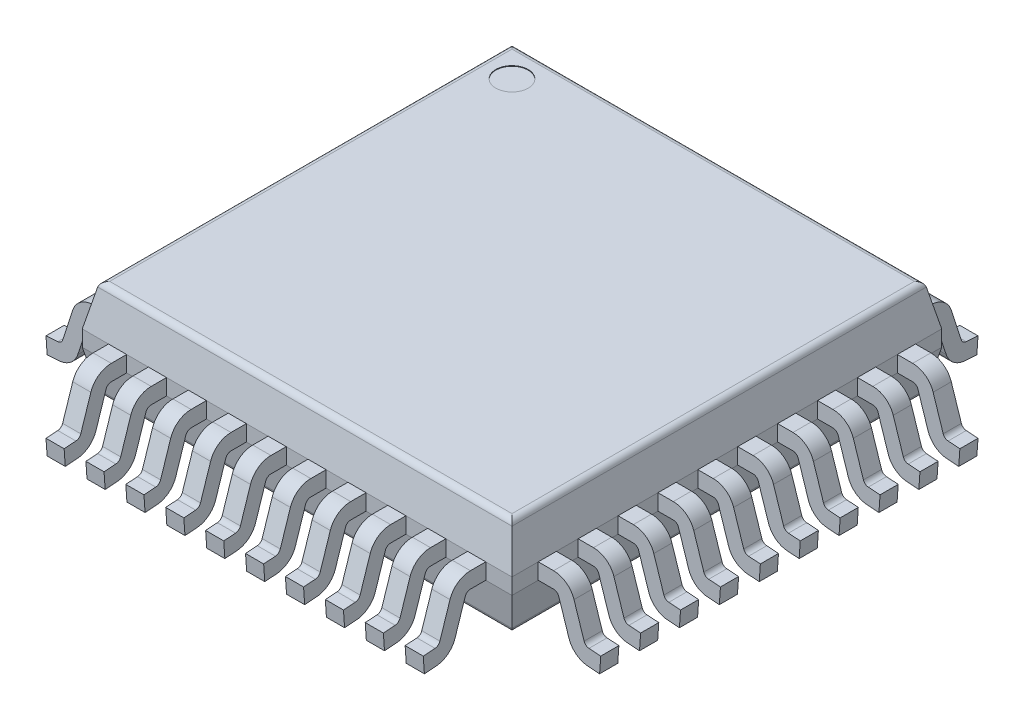
from build123d import *
from OCP.BRepFilletAPI import BRepFilletAPI_MakeChamfer

# Parameters (mm, degrees)
SKETCH1_W             = 7
SKETCH1_H             = 7
BODY_DEPTH            = 1.6
BODY_CHAMFER_SIZE     = 0.67
BODY_CHAMFER_SIZE2    = 0.142412896
FILLET1_R             = 0.1
SKETCH2_R             = 0.263534387
PIN_1_INDENT_DEPTH    = 0.01
PIN_DEPTH             = 0.147727273
LPATTERN1_COUNT       = 10
LPATTERN1_PITCH       = 0.65
MIRROR1_COPY_1_DEPTH  = 0.147727273
MIRROR1_COPY_2_DEPTH  = 0.147727273
MIRROR1_COPY_3_DEPTH  = 0.147727273
MIRROR1_COPY_4_DEPTH  = 0.147727273
MIRROR1_COPY_5_DEPTH  = 0.147727273
MIRROR1_COPY_6_DEPTH  = 0.147727273
MIRROR1_COPY_7_DEPTH  = 0.147727273
MIRROR1_COPY_8_DEPTH  = 0.147727273
MIRROR1_COPY_9_DEPTH  = 0.147727273
MIRROR2_COPY_1_DEPTH  = 0.147727273
MIRROR2_COPY_2_DEPTH  = 0.147727273
MIRROR2_COPY_3_DEPTH  = 0.147727273
MIRROR2_COPY_4_DEPTH  = 0.147727273
MIRROR2_COPY_5_DEPTH  = 0.147727273
MIRROR2_COPY_6_DEPTH  = 0.147727273
MIRROR2_COPY_7_DEPTH  = 0.147727273
MIRROR2_COPY_8_DEPTH  = 0.147727273
MIRROR2_COPY_9_DEPTH  = 0.147727273
MIRROR2_COPY_10_DEPTH = 0.147727273
MIRROR2_COPY_11_DEPTH = 0.147727273
MIRROR3_START         = -3.072727273
MIRROR3_DEPTH         = 0.295454546
MIRROR3_START_2       = -2.422727273
MIRROR3_2_DEPTH       = 0.295454546
MIRROR3_START_3       = -1.772727273
MIRROR3_3_DEPTH       = 0.295454546
MIRROR3_START_4       = -1.122727273
MIRROR3_4_DEPTH       = 0.295454546
MIRROR3_START_5       = -0.472727273
MIRROR3_5_DEPTH       = 0.295454546
MIRROR3_START_6       = 0.177272727
MIRROR3_6_DEPTH       = 0.295454546
MIRROR3_START_7       = 0.827272727
MIRROR3_7_DEPTH       = 0.295454546
MIRROR3_START_8       = 1.477272727
MIRROR3_8_DEPTH       = 0.295454546
MIRROR3_START_9       = 2.127272727
MIRROR3_9_DEPTH       = 0.295454546
MIRROR3_START_10      = 2.777272727
MIRROR3_10_DEPTH      = 0.295454546


# Read off the part's stored shape, not the designer's step: Mirror3
with BuildPart() as part:
    # Sketch1 → Body (new body)
    with BuildSketch(Plane(origin=(0, 0.15, 0), x_dir=(-1, 0, 0), z_dir=(0, 1, 0))):
        Rectangle(SKETCH1_W, SKETCH1_H)
    extrude(amount=BODY_DEPTH)

    # Body Chamfer: one chamfer whose edges measure the first distance from different faces: ONE call of the kernel's chamfer builder (chamfer() names one face for all edges)
    body_chamfer_edges_1 = [part.edges().sort_by_distance(p)[0] for p in [
        (3.5, 1.75, 0),
        (3.5, 0.15, 0),
    ]]
    body_chamfer_side_1 = [part.faces().sort_by_distance(p)[0] for p in [
        (3.5, 0.95, 0),
    ]]
    body_chamfer_edges_2 = [part.edges().sort_by_distance(p)[0] for p in [
        (0, 1.75, -3.5),
        (0, 0.15, -3.5),
    ]]
    body_chamfer_side_2 = [part.faces().sort_by_distance(p)[0] for p in [
        (0, 0.95, -3.5),
    ]]
    body_chamfer_edges_3 = [part.edges().sort_by_distance(p)[0] for p in [
        (-3.5, 1.75, 0),
        (-3.5, 0.15, 0),
    ]]
    body_chamfer_side_3 = [part.faces().sort_by_distance(p)[0] for p in [
        (-3.5, 0.95, 0),
    ]]
    body_chamfer_edges_4 = [part.edges().sort_by_distance(p)[0] for p in [
        (0, 0.15, 3.5),
        (0, 1.75, 3.5),
    ]]
    body_chamfer_side_4 = [part.faces().sort_by_distance(p)[0] for p in [
        (0, 0.95, 3.5),
    ]]
    body_chamfer = BRepFilletAPI_MakeChamfer(part.part.solid().wrapped)
    for e in body_chamfer_edges_1:
        body_chamfer.Add(BODY_CHAMFER_SIZE, BODY_CHAMFER_SIZE2, e.wrapped, body_chamfer_side_1[0].wrapped)  # the first distance lies on this face
    for e in body_chamfer_edges_2:
        body_chamfer.Add(BODY_CHAMFER_SIZE, BODY_CHAMFER_SIZE2, e.wrapped, body_chamfer_side_2[0].wrapped)  # the first distance lies on this face
    for e in body_chamfer_edges_3:
        body_chamfer.Add(BODY_CHAMFER_SIZE, BODY_CHAMFER_SIZE2, e.wrapped, body_chamfer_side_3[0].wrapped)  # the first distance lies on this face
    for e in body_chamfer_edges_4:
        body_chamfer.Add(BODY_CHAMFER_SIZE, BODY_CHAMFER_SIZE2, e.wrapped, body_chamfer_side_4[0].wrapped)  # the first distance lies on this face
    add(Compound.cast(body_chamfer.Shape()), mode=Mode.REPLACE)

    # Fillet1
    fillet1_edges = [part.edges().sort_by_distance(p)[0] for p in [
        (-3.357587104, 0.15, 0),
        (0, 0.15, -3.357587104),
        (3.357587104, 0.15, 0),
        (0, 0.15, 3.357587104),
        (-3.357587104, 1.75, 0),
        (0, 1.75, 3.357587104),
        (3.357587104, 1.75, 0),
        (0, 1.75, -3.357587104),
    ]]
    fillet(fillet1_edges, radius=FILLET1_R)

    # Sketch2 → Pin #1 Indent (cut)
    with BuildSketch(Plane(origin=(0, 1.75, 0), x_dir=(1, 0, 0), z_dir=(0, 1, 0))):
        with Locations(Location((-2.857587104, 2.857587104, 0), (0, 0, 270))):
            Circle(SKETCH2_R)
    extrude(amount=-PIN_1_INDENT_DEPTH, mode=Mode.SUBTRACT)

    # Sketch3 → Pin (add, symmetric)
    with BuildSketch(Plane.XY.offset(2.925)):
        with BuildLine():
            Line((-4.5, 0), (-4.308319039, 0.013403639))
            ThreePointArc((-4.308319039, 0.013403639), (-4.11742537, 0.086612153), (-4, 0.253977508))
            Line((-4, 0.253977508), (-3.835560121, 0.757918912))
            ThreePointArc((-3.835560121, 0.757918912), (-3.80285498, 0.802844705), (-3.75, 0.82))
            Line((-3.75, 0.82), (-3.5, 0.82))
            Line((-3.5, 0.82), (-3.5, 1.08))
            Line((-3.5, 1.08), (-3.75, 1.08))
            ThreePointArc((-3.75, 1.08), (-3.955547146, 1.013284964), (-4.082733804, 0.838573548))
            Line((-4.082733804, 0.838573548), (-4.247173683, 0.334632144))
            ThreePointArc((-4.247173683, 0.334632144), (-4.277368778, 0.291595338), (-4.326455722, 0.272770292))
            Line((-4.326455722, 0.272770292), (-4.518136683, 0.259366653))
            Line((-4.518136683, 0.259366653), (-4.5, 0))
        make_face()
    pin = extrude(amount=PIN_DEPTH, both=True)

    # LPattern1: Pin ×10
    with Locations(*[(0, 0, -i * LPATTERN1_PITCH) for i in range(1, LPATTERN1_COUNT)]):
        add(pin)

    # Mirror1: Pin across plane
    add(pin.mirror(Plane(origin=(0, 0, 0), x_dir=(-0.7071067811865563, 0, 0.7071067811865387), z_dir=(0.7071067811865389, 0, 0.7071067811865562))))

    # Mirror1 copy 1 sketch → Mirror1 copy 1 (add, symmetric)
    with BuildSketch(Plane(origin=(-2.275, 0, 0), x_dir=(0, 0, -1), z_dir=(-1, 0, 0))):
        with BuildLine():
            Line((-4.5, 0), (-4.308319039, -0.013403639))
            ThreePointArc((-4.308319039, -0.013403639), (-4.11742537, -0.086612153), (-4, -0.253977508))
            Line((-4, -0.253977508), (-3.835560121, -0.757918912))
            ThreePointArc((-3.835560121, -0.757918912), (-3.80285498, -0.802844705), (-3.75, -0.82))
            Line((-3.75, -0.82), (-3.5, -0.82))
            Line((-3.5, -0.82), (-3.5, -1.08))
            Line((-3.5, -1.08), (-3.75, -1.08))
            ThreePointArc((-3.75, -1.08), (-3.955547146, -1.013284964), (-4.082733804, -0.838573548))
            Line((-4.082733804, -0.838573548), (-4.247173683, -0.334632144))
            ThreePointArc((-4.247173683, -0.334632144), (-4.277368778, -0.291595338), (-4.326455722, -0.272770292))
            Line((-4.326455722, -0.272770292), (-4.518136683, -0.259366653))
            Line((-4.518136683, -0.259366653), (-4.5, 0))
        make_face()
    extrude(amount=MIRROR1_COPY_1_DEPTH, both=True)

    # Mirror1 copy 2 sketch → Mirror1 copy 2 (add, symmetric)
    with BuildSketch(Plane(origin=(-1.625, 0, 0), x_dir=(0, 0, -1), z_dir=(-1, 0, 0))):
        with BuildLine():
            Line((-4.5, 0), (-4.308319039, -0.013403639))
            ThreePointArc((-4.308319039, -0.013403639), (-4.11742537, -0.086612153), (-4, -0.253977508))
            Line((-4, -0.253977508), (-3.835560121, -0.757918912))
            ThreePointArc((-3.835560121, -0.757918912), (-3.80285498, -0.802844705), (-3.75, -0.82))
            Line((-3.75, -0.82), (-3.5, -0.82))
            Line((-3.5, -0.82), (-3.5, -1.08))
            Line((-3.5, -1.08), (-3.75, -1.08))
            ThreePointArc((-3.75, -1.08), (-3.955547146, -1.013284964), (-4.082733804, -0.838573548))
            Line((-4.082733804, -0.838573548), (-4.247173683, -0.334632144))
            ThreePointArc((-4.247173683, -0.334632144), (-4.277368778, -0.291595338), (-4.326455722, -0.272770292))
            Line((-4.326455722, -0.272770292), (-4.518136683, -0.259366653))
            Line((-4.518136683, -0.259366653), (-4.5, 0))
        make_face()
    extrude(amount=MIRROR1_COPY_2_DEPTH, both=True)

    # Mirror1 copy 3 sketch → Mirror1 copy 3 (add, symmetric)
    with BuildSketch(Plane(origin=(-0.975, 0, 0), x_dir=(0, 0, -1), z_dir=(-1, 0, 0))):
        with BuildLine():
            Line((-4.5, 0), (-4.308319039, -0.013403639))
            ThreePointArc((-4.308319039, -0.013403639), (-4.11742537, -0.086612153), (-4, -0.253977508))
            Line((-4, -0.253977508), (-3.835560121, -0.757918912))
            ThreePointArc((-3.835560121, -0.757918912), (-3.80285498, -0.802844705), (-3.75, -0.82))
            Line((-3.75, -0.82), (-3.5, -0.82))
            Line((-3.5, -0.82), (-3.5, -1.08))
            Line((-3.5, -1.08), (-3.75, -1.08))
            ThreePointArc((-3.75, -1.08), (-3.955547146, -1.013284964), (-4.082733804, -0.838573548))
            Line((-4.082733804, -0.838573548), (-4.247173683, -0.334632144))
            ThreePointArc((-4.247173683, -0.334632144), (-4.277368778, -0.291595338), (-4.326455722, -0.272770292))
            Line((-4.326455722, -0.272770292), (-4.518136683, -0.259366653))
            Line((-4.518136683, -0.259366653), (-4.5, 0))
        make_face()
    extrude(amount=MIRROR1_COPY_3_DEPTH, both=True)

    # Mirror1 copy 4 sketch → Mirror1 copy 4 (add, symmetric)
    with BuildSketch(Plane(origin=(-0.325, 0, 0), x_dir=(0, 0, -1), z_dir=(-1, 0, 0))):
        with BuildLine():
            Line((-4.5, 0), (-4.308319039, -0.013403639))
            ThreePointArc((-4.308319039, -0.013403639), (-4.11742537, -0.086612153), (-4, -0.253977508))
            Line((-4, -0.253977508), (-3.835560121, -0.757918912))
            ThreePointArc((-3.835560121, -0.757918912), (-3.80285498, -0.802844705), (-3.75, -0.82))
            Line((-3.75, -0.82), (-3.5, -0.82))
            Line((-3.5, -0.82), (-3.5, -1.08))
            Line((-3.5, -1.08), (-3.75, -1.08))
            ThreePointArc((-3.75, -1.08), (-3.955547146, -1.013284964), (-4.082733804, -0.838573548))
            Line((-4.082733804, -0.838573548), (-4.247173683, -0.334632144))
            ThreePointArc((-4.247173683, -0.334632144), (-4.277368778, -0.291595338), (-4.326455722, -0.272770292))
            Line((-4.326455722, -0.272770292), (-4.518136683, -0.259366653))
            Line((-4.518136683, -0.259366653), (-4.5, 0))
        make_face()
    extrude(amount=MIRROR1_COPY_4_DEPTH, both=True)

    # Mirror1 copy 5 sketch → Mirror1 copy 5 (add, symmetric)
    with BuildSketch(Plane(origin=(0.325, 0, 0), x_dir=(0, 0, -1), z_dir=(-1, 0, 0))):
        with BuildLine():
            Line((-4.5, 0), (-4.308319039, -0.013403639))
            ThreePointArc((-4.308319039, -0.013403639), (-4.11742537, -0.086612153), (-4, -0.253977508))
            Line((-4, -0.253977508), (-3.835560121, -0.757918912))
            ThreePointArc((-3.835560121, -0.757918912), (-3.80285498, -0.802844705), (-3.75, -0.82))
            Line((-3.75, -0.82), (-3.5, -0.82))
            Line((-3.5, -0.82), (-3.5, -1.08))
            Line((-3.5, -1.08), (-3.75, -1.08))
            ThreePointArc((-3.75, -1.08), (-3.955547146, -1.013284964), (-4.082733804, -0.838573548))
            Line((-4.082733804, -0.838573548), (-4.247173683, -0.334632144))
            ThreePointArc((-4.247173683, -0.334632144), (-4.277368778, -0.291595338), (-4.326455722, -0.272770292))
            Line((-4.326455722, -0.272770292), (-4.518136683, -0.259366653))
            Line((-4.518136683, -0.259366653), (-4.5, 0))
        make_face()
    extrude(amount=MIRROR1_COPY_5_DEPTH, both=True)

    # Mirror1 copy 6 sketch → Mirror1 copy 6 (add, symmetric)
    with BuildSketch(Plane(origin=(0.975, 0, 0), x_dir=(0, 0, -1), z_dir=(-1, 0, 0))):
        with BuildLine():
            Line((-4.5, 0), (-4.308319039, -0.013403639))
            ThreePointArc((-4.308319039, -0.013403639), (-4.11742537, -0.086612153), (-4, -0.253977508))
            Line((-4, -0.253977508), (-3.835560121, -0.757918912))
            ThreePointArc((-3.835560121, -0.757918912), (-3.80285498, -0.802844705), (-3.75, -0.82))
            Line((-3.75, -0.82), (-3.5, -0.82))
            Line((-3.5, -0.82), (-3.5, -1.08))
            Line((-3.5, -1.08), (-3.75, -1.08))
            ThreePointArc((-3.75, -1.08), (-3.955547146, -1.013284964), (-4.082733804, -0.838573548))
            Line((-4.082733804, -0.838573548), (-4.247173683, -0.334632144))
            ThreePointArc((-4.247173683, -0.334632144), (-4.277368778, -0.291595338), (-4.326455722, -0.272770292))
            Line((-4.326455722, -0.272770292), (-4.518136683, -0.259366653))
            Line((-4.518136683, -0.259366653), (-4.5, 0))
        make_face()
    extrude(amount=MIRROR1_COPY_6_DEPTH, both=True)

    # Mirror1 copy 7 sketch → Mirror1 copy 7 (add, symmetric)
    with BuildSketch(Plane(origin=(1.625, 0, 0), x_dir=(0, 0, -1), z_dir=(-1, 0, 0))):
        with BuildLine():
            Line((-4.5, 0), (-4.308319039, -0.013403639))
            ThreePointArc((-4.308319039, -0.013403639), (-4.11742537, -0.086612153), (-4, -0.253977508))
            Line((-4, -0.253977508), (-3.835560121, -0.757918912))
            ThreePointArc((-3.835560121, -0.757918912), (-3.80285498, -0.802844705), (-3.75, -0.82))
            Line((-3.75, -0.82), (-3.5, -0.82))
            Line((-3.5, -0.82), (-3.5, -1.08))
            Line((-3.5, -1.08), (-3.75, -1.08))
            ThreePointArc((-3.75, -1.08), (-3.955547146, -1.013284964), (-4.082733804, -0.838573548))
            Line((-4.082733804, -0.838573548), (-4.247173683, -0.334632144))
            ThreePointArc((-4.247173683, -0.334632144), (-4.277368778, -0.291595338), (-4.326455722, -0.272770292))
            Line((-4.326455722, -0.272770292), (-4.518136683, -0.259366653))
            Line((-4.518136683, -0.259366653), (-4.5, 0))
        make_face()
    extrude(amount=MIRROR1_COPY_7_DEPTH, both=True)

    # Mirror1 copy 8 sketch → Mirror1 copy 8 (add, symmetric)
    with BuildSketch(Plane(origin=(2.275, 0, 0), x_dir=(0, 0, -1), z_dir=(-1, 0, 0))):
        with BuildLine():
            Line((-4.5, 0), (-4.308319039, -0.013403639))
            ThreePointArc((-4.308319039, -0.013403639), (-4.11742537, -0.086612153), (-4, -0.253977508))
            Line((-4, -0.253977508), (-3.835560121, -0.757918912))
            ThreePointArc((-3.835560121, -0.757918912), (-3.80285498, -0.802844705), (-3.75, -0.82))
            Line((-3.75, -0.82), (-3.5, -0.82))
            Line((-3.5, -0.82), (-3.5, -1.08))
            Line((-3.5, -1.08), (-3.75, -1.08))
            ThreePointArc((-3.75, -1.08), (-3.955547146, -1.013284964), (-4.082733804, -0.838573548))
            Line((-4.082733804, -0.838573548), (-4.247173683, -0.334632144))
            ThreePointArc((-4.247173683, -0.334632144), (-4.277368778, -0.291595338), (-4.326455722, -0.272770292))
            Line((-4.326455722, -0.272770292), (-4.518136683, -0.259366653))
            Line((-4.518136683, -0.259366653), (-4.5, 0))
        make_face()
    extrude(amount=MIRROR1_COPY_8_DEPTH, both=True)

    # Mirror1 copy 9 sketch → Mirror1 copy 9 (add, symmetric)
    with BuildSketch(Plane(origin=(2.925, 0, 0), x_dir=(0, 0, -1), z_dir=(-1, 0, 0))):
        with BuildLine():
            Line((-4.5, 0), (-4.308319039, -0.013403639))
            ThreePointArc((-4.308319039, -0.013403639), (-4.11742537, -0.086612153), (-4, -0.253977508))
            Line((-4, -0.253977508), (-3.835560121, -0.757918912))
            ThreePointArc((-3.835560121, -0.757918912), (-3.80285498, -0.802844705), (-3.75, -0.82))
            Line((-3.75, -0.82), (-3.5, -0.82))
            Line((-3.5, -0.82), (-3.5, -1.08))
            Line((-3.5, -1.08), (-3.75, -1.08))
            ThreePointArc((-3.75, -1.08), (-3.955547146, -1.013284964), (-4.082733804, -0.838573548))
            Line((-4.082733804, -0.838573548), (-4.247173683, -0.334632144))
            ThreePointArc((-4.247173683, -0.334632144), (-4.277368778, -0.291595338), (-4.326455722, -0.272770292))
            Line((-4.326455722, -0.272770292), (-4.518136683, -0.259366653))
            Line((-4.518136683, -0.259366653), (-4.5, 0))
        make_face()
    extrude(amount=MIRROR1_COPY_9_DEPTH, both=True)

    # Mirror2 copy 1 sketch → Mirror2 copy 1 (add, symmetric)
    with BuildSketch(Plane.ZY.offset(2.925)):
        with BuildLine():
            Line((-4.5, 0), (-4.308319039, 0.013403639))
            ThreePointArc((-4.308319039, 0.013403639), (-4.11742537, 0.086612153), (-4, 0.253977508))
            Line((-4, 0.253977508), (-3.835560121, 0.757918912))
            ThreePointArc((-3.835560121, 0.757918912), (-3.80285498, 0.802844705), (-3.75, 0.82))
            Line((-3.75, 0.82), (-3.5, 0.82))
            Line((-3.5, 0.82), (-3.5, 1.08))
            Line((-3.5, 1.08), (-3.75, 1.08))
            ThreePointArc((-3.75, 1.08), (-3.955547146, 1.013284964), (-4.082733804, 0.838573548))
            Line((-4.082733804, 0.838573548), (-4.247173683, 0.334632144))
            ThreePointArc((-4.247173683, 0.334632144), (-4.277368778, 0.291595338), (-4.326455722, 0.272770292))
            Line((-4.326455722, 0.272770292), (-4.518136683, 0.259366653))
            Line((-4.518136683, 0.259366653), (-4.5, 0))
        make_face()
    extrude(amount=MIRROR2_COPY_1_DEPTH, both=True)

    # Mirror2 copy 2 sketch → Mirror2 copy 2 (add, symmetric)
    with BuildSketch(Plane.ZY.offset(2.275)):
        with BuildLine():
            Line((-4.5, 0), (-4.308319039, 0.013403639))
            ThreePointArc((-4.308319039, 0.013403639), (-4.11742537, 0.086612153), (-4, 0.253977508))
            Line((-4, 0.253977508), (-3.835560121, 0.757918912))
            ThreePointArc((-3.835560121, 0.757918912), (-3.80285498, 0.802844705), (-3.75, 0.82))
            Line((-3.75, 0.82), (-3.5, 0.82))
            Line((-3.5, 0.82), (-3.5, 1.08))
            Line((-3.5, 1.08), (-3.75, 1.08))
            ThreePointArc((-3.75, 1.08), (-3.955547146, 1.013284964), (-4.082733804, 0.838573548))
            Line((-4.082733804, 0.838573548), (-4.247173683, 0.334632144))
            ThreePointArc((-4.247173683, 0.334632144), (-4.277368778, 0.291595338), (-4.326455722, 0.272770292))
            Line((-4.326455722, 0.272770292), (-4.518136683, 0.259366653))
            Line((-4.518136683, 0.259366653), (-4.5, 0))
        make_face()
    extrude(amount=MIRROR2_COPY_2_DEPTH, both=True)

    # Mirror2 copy 3 sketch → Mirror2 copy 3 (add, symmetric)
    with BuildSketch(Plane.ZY.offset(1.625)):
        with BuildLine():
            Line((-4.5, 0), (-4.308319039, 0.013403639))
            ThreePointArc((-4.308319039, 0.013403639), (-4.11742537, 0.086612153), (-4, 0.253977508))
            Line((-4, 0.253977508), (-3.835560121, 0.757918912))
            ThreePointArc((-3.835560121, 0.757918912), (-3.80285498, 0.802844705), (-3.75, 0.82))
            Line((-3.75, 0.82), (-3.5, 0.82))
            Line((-3.5, 0.82), (-3.5, 1.08))
            Line((-3.5, 1.08), (-3.75, 1.08))
            ThreePointArc((-3.75, 1.08), (-3.955547146, 1.013284964), (-4.082733804, 0.838573548))
            Line((-4.082733804, 0.838573548), (-4.247173683, 0.334632144))
            ThreePointArc((-4.247173683, 0.334632144), (-4.277368778, 0.291595338), (-4.326455722, 0.272770292))
            Line((-4.326455722, 0.272770292), (-4.518136683, 0.259366653))
            Line((-4.518136683, 0.259366653), (-4.5, 0))
        make_face()
    extrude(amount=MIRROR2_COPY_3_DEPTH, both=True)

    # Mirror2 copy 4 sketch → Mirror2 copy 4 (add, symmetric)
    with BuildSketch(Plane.ZY.offset(0.975)):
        with BuildLine():
            Line((-4.5, 0), (-4.308319039, 0.013403639))
            ThreePointArc((-4.308319039, 0.013403639), (-4.11742537, 0.086612153), (-4, 0.253977508))
            Line((-4, 0.253977508), (-3.835560121, 0.757918912))
            ThreePointArc((-3.835560121, 0.757918912), (-3.80285498, 0.802844705), (-3.75, 0.82))
            Line((-3.75, 0.82), (-3.5, 0.82))
            Line((-3.5, 0.82), (-3.5, 1.08))
            Line((-3.5, 1.08), (-3.75, 1.08))
            ThreePointArc((-3.75, 1.08), (-3.955547146, 1.013284964), (-4.082733804, 0.838573548))
            Line((-4.082733804, 0.838573548), (-4.247173683, 0.334632144))
            ThreePointArc((-4.247173683, 0.334632144), (-4.277368778, 0.291595338), (-4.326455722, 0.272770292))
            Line((-4.326455722, 0.272770292), (-4.518136683, 0.259366653))
            Line((-4.518136683, 0.259366653), (-4.5, 0))
        make_face()
    extrude(amount=MIRROR2_COPY_4_DEPTH, both=True)

    # Mirror2 copy 5 sketch → Mirror2 copy 5 (add, symmetric)
    with BuildSketch(Plane.ZY.offset(0.325)):
        with BuildLine():
            Line((-4.5, 0), (-4.308319039, 0.013403639))
            ThreePointArc((-4.308319039, 0.013403639), (-4.11742537, 0.086612153), (-4, 0.253977508))
            Line((-4, 0.253977508), (-3.835560121, 0.757918912))
            ThreePointArc((-3.835560121, 0.757918912), (-3.80285498, 0.802844705), (-3.75, 0.82))
            Line((-3.75, 0.82), (-3.5, 0.82))
            Line((-3.5, 0.82), (-3.5, 1.08))
            Line((-3.5, 1.08), (-3.75, 1.08))
            ThreePointArc((-3.75, 1.08), (-3.955547146, 1.013284964), (-4.082733804, 0.838573548))
            Line((-4.082733804, 0.838573548), (-4.247173683, 0.334632144))
            ThreePointArc((-4.247173683, 0.334632144), (-4.277368778, 0.291595338), (-4.326455722, 0.272770292))
            Line((-4.326455722, 0.272770292), (-4.518136683, 0.259366653))
            Line((-4.518136683, 0.259366653), (-4.5, 0))
        make_face()
    extrude(amount=MIRROR2_COPY_5_DEPTH, both=True)

    # Mirror2 copy 6 sketch → Mirror2 copy 6 (add, symmetric)
    with BuildSketch(Plane.ZY.offset(-0.325)):
        with BuildLine():
            Line((-4.5, 0), (-4.308319039, 0.013403639))
            ThreePointArc((-4.308319039, 0.013403639), (-4.11742537, 0.086612153), (-4, 0.253977508))
            Line((-4, 0.253977508), (-3.835560121, 0.757918912))
            ThreePointArc((-3.835560121, 0.757918912), (-3.80285498, 0.802844705), (-3.75, 0.82))
            Line((-3.75, 0.82), (-3.5, 0.82))
            Line((-3.5, 0.82), (-3.5, 1.08))
            Line((-3.5, 1.08), (-3.75, 1.08))
            ThreePointArc((-3.75, 1.08), (-3.955547146, 1.013284964), (-4.082733804, 0.838573548))
            Line((-4.082733804, 0.838573548), (-4.247173683, 0.334632144))
            ThreePointArc((-4.247173683, 0.334632144), (-4.277368778, 0.291595338), (-4.326455722, 0.272770292))
            Line((-4.326455722, 0.272770292), (-4.518136683, 0.259366653))
            Line((-4.518136683, 0.259366653), (-4.5, 0))
        make_face()
    extrude(amount=MIRROR2_COPY_6_DEPTH, both=True)

    # Mirror2 copy 7 sketch → Mirror2 copy 7 (add, symmetric)
    with BuildSketch(Plane.ZY.offset(-0.975)):
        with BuildLine():
            Line((-4.5, 0), (-4.308319039, 0.013403639))
            ThreePointArc((-4.308319039, 0.013403639), (-4.11742537, 0.086612153), (-4, 0.253977508))
            Line((-4, 0.253977508), (-3.835560121, 0.757918912))
            ThreePointArc((-3.835560121, 0.757918912), (-3.80285498, 0.802844705), (-3.75, 0.82))
            Line((-3.75, 0.82), (-3.5, 0.82))
            Line((-3.5, 0.82), (-3.5, 1.08))
            Line((-3.5, 1.08), (-3.75, 1.08))
            ThreePointArc((-3.75, 1.08), (-3.955547146, 1.013284964), (-4.082733804, 0.838573548))
            Line((-4.082733804, 0.838573548), (-4.247173683, 0.334632144))
            ThreePointArc((-4.247173683, 0.334632144), (-4.277368778, 0.291595338), (-4.326455722, 0.272770292))
            Line((-4.326455722, 0.272770292), (-4.518136683, 0.259366653))
            Line((-4.518136683, 0.259366653), (-4.5, 0))
        make_face()
    extrude(amount=MIRROR2_COPY_7_DEPTH, both=True)

    # Mirror2 copy 8 sketch → Mirror2 copy 8 (add, symmetric)
    with BuildSketch(Plane.ZY.offset(-1.625)):
        with BuildLine():
            Line((-4.5, 0), (-4.308319039, 0.013403639))
            ThreePointArc((-4.308319039, 0.013403639), (-4.11742537, 0.086612153), (-4, 0.253977508))
            Line((-4, 0.253977508), (-3.835560121, 0.757918912))
            ThreePointArc((-3.835560121, 0.757918912), (-3.80285498, 0.802844705), (-3.75, 0.82))
            Line((-3.75, 0.82), (-3.5, 0.82))
            Line((-3.5, 0.82), (-3.5, 1.08))
            Line((-3.5, 1.08), (-3.75, 1.08))
            ThreePointArc((-3.75, 1.08), (-3.955547146, 1.013284964), (-4.082733804, 0.838573548))
            Line((-4.082733804, 0.838573548), (-4.247173683, 0.334632144))
            ThreePointArc((-4.247173683, 0.334632144), (-4.277368778, 0.291595338), (-4.326455722, 0.272770292))
            Line((-4.326455722, 0.272770292), (-4.518136683, 0.259366653))
            Line((-4.518136683, 0.259366653), (-4.5, 0))
        make_face()
    extrude(amount=MIRROR2_COPY_8_DEPTH, both=True)

    # Mirror2 copy 9 sketch → Mirror2 copy 9 (add, symmetric)
    with BuildSketch(Plane.ZY.offset(-2.275)):
        with BuildLine():
            Line((-4.5, 0), (-4.308319039, 0.013403639))
            ThreePointArc((-4.308319039, 0.013403639), (-4.11742537, 0.086612153), (-4, 0.253977508))
            Line((-4, 0.253977508), (-3.835560121, 0.757918912))
            ThreePointArc((-3.835560121, 0.757918912), (-3.80285498, 0.802844705), (-3.75, 0.82))
            Line((-3.75, 0.82), (-3.5, 0.82))
            Line((-3.5, 0.82), (-3.5, 1.08))
            Line((-3.5, 1.08), (-3.75, 1.08))
            ThreePointArc((-3.75, 1.08), (-3.955547146, 1.013284964), (-4.082733804, 0.838573548))
            Line((-4.082733804, 0.838573548), (-4.247173683, 0.334632144))
            ThreePointArc((-4.247173683, 0.334632144), (-4.277368778, 0.291595338), (-4.326455722, 0.272770292))
            Line((-4.326455722, 0.272770292), (-4.518136683, 0.259366653))
            Line((-4.518136683, 0.259366653), (-4.5, 0))
        make_face()
    extrude(amount=MIRROR2_COPY_9_DEPTH, both=True)

    # Mirror2 copy 10 sketch → Mirror2 copy 10 (add, symmetric)
    with BuildSketch(Plane.ZY.offset(-2.925)):
        with BuildLine():
            Line((-4.5, 0), (-4.308319039, 0.013403639))
            ThreePointArc((-4.308319039, 0.013403639), (-4.11742537, 0.086612153), (-4, 0.253977508))
            Line((-4, 0.253977508), (-3.835560121, 0.757918912))
            ThreePointArc((-3.835560121, 0.757918912), (-3.80285498, 0.802844705), (-3.75, 0.82))
            Line((-3.75, 0.82), (-3.5, 0.82))
            Line((-3.5, 0.82), (-3.5, 1.08))
            Line((-3.5, 1.08), (-3.75, 1.08))
            ThreePointArc((-3.75, 1.08), (-3.955547146, 1.013284964), (-4.082733804, 0.838573548))
            Line((-4.082733804, 0.838573548), (-4.247173683, 0.334632144))
            ThreePointArc((-4.247173683, 0.334632144), (-4.277368778, 0.291595338), (-4.326455722, 0.272770292))
            Line((-4.326455722, 0.272770292), (-4.518136683, 0.259366653))
            Line((-4.518136683, 0.259366653), (-4.5, 0))
        make_face()
    extrude(amount=MIRROR2_COPY_10_DEPTH, both=True)

    # Mirror2 copy 11 sketch → Mirror2 copy 11 (add, symmetric)
    with BuildSketch(Plane(origin=(0, 0, -2.925), x_dir=(1, 0, 0), z_dir=(0, 0, -1))):
        with BuildLine():
            Line((-4.5, 0), (-4.308319039, -0.013403639))
            ThreePointArc((-4.308319039, -0.013403639), (-4.11742537, -0.086612153), (-4, -0.253977508))
            Line((-4, -0.253977508), (-3.835560121, -0.757918912))
            ThreePointArc((-3.835560121, -0.757918912), (-3.80285498, -0.802844705), (-3.75, -0.82))
            Line((-3.75, -0.82), (-3.5, -0.82))
            Line((-3.5, -0.82), (-3.5, -1.08))
            Line((-3.5, -1.08), (-3.75, -1.08))
            ThreePointArc((-3.75, -1.08), (-3.955547146, -1.013284964), (-4.082733804, -0.838573548))
            Line((-4.082733804, -0.838573548), (-4.247173683, -0.334632144))
            ThreePointArc((-4.247173683, -0.334632144), (-4.277368778, -0.291595338), (-4.326455722, -0.272770292))
            Line((-4.326455722, -0.272770292), (-4.518136683, -0.259366653))
            Line((-4.518136683, -0.259366653), (-4.5, 0))
        make_face()
    extrude(amount=MIRROR2_COPY_11_DEPTH, both=True)

    # Mirror3 outline → Mirror3 (add)
    with BuildSketch(Plane.XY.offset(MIRROR3_START)):
        with BuildLine():
            Line((3.5, 0.82), (3.75, 0.82))
            ThreePointArc((3.75, 0.82), (3.80285498, 0.802844705), (3.835560121, 0.757918912))
            Line((3.835560121, 0.757918912), (4, 0.253977508))
            ThreePointArc((4, 0.253977508), (4.11742537, 0.086612153), (4.308319039, 0.013403639))
            Line((4.308319039, 0.013403639), (4.5, 0))
            Line((4.5, 0), (4.518136683, 0.259366653))
            Line((4.518136683, 0.259366653), (4.326455722, 0.272770292))
            ThreePointArc((4.326455722, 0.272770292), (4.277368778, 0.291595338), (4.247173683, 0.334632144))
            Line((4.247173683, 0.334632144), (4.082733804, 0.838573548))
            ThreePointArc((4.082733804, 0.838573548), (3.955547146, 1.013284964), (3.75, 1.08))
            Line((3.75, 1.08), (3.5, 1.08))
            Line((3.5, 1.08), (3.5, 0.82))
        make_face()
    extrude(amount=MIRROR3_DEPTH)

    # Mirror3 2 outline → Mirror3 2 (add)
    with BuildSketch(Plane.XY.offset(MIRROR3_START_2)):
        with BuildLine():
            Line((3.5, 0.82), (3.75, 0.82))
            ThreePointArc((3.75, 0.82), (3.80285498, 0.802844705), (3.835560121, 0.757918912))
            Line((3.835560121, 0.757918912), (4, 0.253977508))
            ThreePointArc((4, 0.253977508), (4.11742537, 0.086612153), (4.308319039, 0.013403639))
            Line((4.308319039, 0.013403639), (4.5, 0))
            Line((4.5, 0), (4.518136683, 0.259366653))
            Line((4.518136683, 0.259366653), (4.326455722, 0.272770292))
            ThreePointArc((4.326455722, 0.272770292), (4.277368778, 0.291595338), (4.247173683, 0.334632144))
            Line((4.247173683, 0.334632144), (4.082733804, 0.838573548))
            ThreePointArc((4.082733804, 0.838573548), (3.955547146, 1.013284964), (3.75, 1.08))
            Line((3.75, 1.08), (3.5, 1.08))
            Line((3.5, 1.08), (3.5, 0.82))
        make_face()
    extrude(amount=MIRROR3_2_DEPTH)

    # Mirror3 3 outline → Mirror3 3 (add)
    with BuildSketch(Plane.XY.offset(MIRROR3_START_3)):
        with BuildLine():
            Line((3.5, 0.82), (3.75, 0.82))
            ThreePointArc((3.75, 0.82), (3.80285498, 0.802844705), (3.835560121, 0.757918912))
            Line((3.835560121, 0.757918912), (4, 0.253977508))
            ThreePointArc((4, 0.253977508), (4.11742537, 0.086612153), (4.308319039, 0.013403639))
            Line((4.308319039, 0.013403639), (4.5, 0))
            Line((4.5, 0), (4.518136683, 0.259366653))
            Line((4.518136683, 0.259366653), (4.326455722, 0.272770292))
            ThreePointArc((4.326455722, 0.272770292), (4.277368778, 0.291595338), (4.247173683, 0.334632144))
            Line((4.247173683, 0.334632144), (4.082733804, 0.838573548))
            ThreePointArc((4.082733804, 0.838573548), (3.955547146, 1.013284964), (3.75, 1.08))
            Line((3.75, 1.08), (3.5, 1.08))
            Line((3.5, 1.08), (3.5, 0.82))
        make_face()
    extrude(amount=MIRROR3_3_DEPTH)

    # Mirror3 4 outline → Mirror3 4 (add)
    with BuildSketch(Plane.XY.offset(MIRROR3_START_4)):
        with BuildLine():
            Line((3.5, 0.82), (3.75, 0.82))
            ThreePointArc((3.75, 0.82), (3.80285498, 0.802844705), (3.835560121, 0.757918912))
            Line((3.835560121, 0.757918912), (4, 0.253977508))
            ThreePointArc((4, 0.253977508), (4.11742537, 0.086612153), (4.308319039, 0.013403639))
            Line((4.308319039, 0.013403639), (4.5, 0))
            Line((4.5, 0), (4.518136683, 0.259366653))
            Line((4.518136683, 0.259366653), (4.326455722, 0.272770292))
            ThreePointArc((4.326455722, 0.272770292), (4.277368778, 0.291595338), (4.247173683, 0.334632144))
            Line((4.247173683, 0.334632144), (4.082733804, 0.838573548))
            ThreePointArc((4.082733804, 0.838573548), (3.955547146, 1.013284964), (3.75, 1.08))
            Line((3.75, 1.08), (3.5, 1.08))
            Line((3.5, 1.08), (3.5, 0.82))
        make_face()
    extrude(amount=MIRROR3_4_DEPTH)

    # Mirror3 5 outline → Mirror3 5 (add)
    with BuildSketch(Plane.XY.offset(MIRROR3_START_5)):
        with BuildLine():
            Line((3.5, 0.82), (3.75, 0.82))
            ThreePointArc((3.75, 0.82), (3.80285498, 0.802844705), (3.835560121, 0.757918912))
            Line((3.835560121, 0.757918912), (4, 0.253977508))
            ThreePointArc((4, 0.253977508), (4.11742537, 0.086612153), (4.308319039, 0.013403639))
            Line((4.308319039, 0.013403639), (4.5, 0))
            Line((4.5, 0), (4.518136683, 0.259366653))
            Line((4.518136683, 0.259366653), (4.326455722, 0.272770292))
            ThreePointArc((4.326455722, 0.272770292), (4.277368778, 0.291595338), (4.247173683, 0.334632144))
            Line((4.247173683, 0.334632144), (4.082733804, 0.838573548))
            ThreePointArc((4.082733804, 0.838573548), (3.955547146, 1.013284964), (3.75, 1.08))
            Line((3.75, 1.08), (3.5, 1.08))
            Line((3.5, 1.08), (3.5, 0.82))
        make_face()
    extrude(amount=MIRROR3_5_DEPTH)

    # Mirror3 6 outline → Mirror3 6 (add)
    with BuildSketch(Plane.XY.offset(MIRROR3_START_6)):
        with BuildLine():
            Line((3.5, 0.82), (3.75, 0.82))
            ThreePointArc((3.75, 0.82), (3.80285498, 0.802844705), (3.835560121, 0.757918912))
            Line((3.835560121, 0.757918912), (4, 0.253977508))
            ThreePointArc((4, 0.253977508), (4.11742537, 0.086612153), (4.308319039, 0.013403639))
            Line((4.308319039, 0.013403639), (4.5, 0))
            Line((4.5, 0), (4.518136683, 0.259366653))
            Line((4.518136683, 0.259366653), (4.326455722, 0.272770292))
            ThreePointArc((4.326455722, 0.272770292), (4.277368778, 0.291595338), (4.247173683, 0.334632144))
            Line((4.247173683, 0.334632144), (4.082733804, 0.838573548))
            ThreePointArc((4.082733804, 0.838573548), (3.955547146, 1.013284964), (3.75, 1.08))
            Line((3.75, 1.08), (3.5, 1.08))
            Line((3.5, 1.08), (3.5, 0.82))
        make_face()
    extrude(amount=MIRROR3_6_DEPTH)

    # Mirror3 7 outline → Mirror3 7 (add)
    with BuildSketch(Plane.XY.offset(MIRROR3_START_7)):
        with BuildLine():
            Line((3.5, 0.82), (3.75, 0.82))
            ThreePointArc((3.75, 0.82), (3.80285498, 0.802844705), (3.835560121, 0.757918912))
            Line((3.835560121, 0.757918912), (4, 0.253977508))
            ThreePointArc((4, 0.253977508), (4.11742537, 0.086612153), (4.308319039, 0.013403639))
            Line((4.308319039, 0.013403639), (4.5, 0))
            Line((4.5, 0), (4.518136683, 0.259366653))
            Line((4.518136683, 0.259366653), (4.326455722, 0.272770292))
            ThreePointArc((4.326455722, 0.272770292), (4.277368778, 0.291595338), (4.247173683, 0.334632144))
            Line((4.247173683, 0.334632144), (4.082733804, 0.838573548))
            ThreePointArc((4.082733804, 0.838573548), (3.955547146, 1.013284964), (3.75, 1.08))
            Line((3.75, 1.08), (3.5, 1.08))
            Line((3.5, 1.08), (3.5, 0.82))
        make_face()
    extrude(amount=MIRROR3_7_DEPTH)

    # Mirror3 8 outline → Mirror3 8 (add)
    with BuildSketch(Plane.XY.offset(MIRROR3_START_8)):
        with BuildLine():
            Line((3.5, 0.82), (3.75, 0.82))
            ThreePointArc((3.75, 0.82), (3.80285498, 0.802844705), (3.835560121, 0.757918912))
            Line((3.835560121, 0.757918912), (4, 0.253977508))
            ThreePointArc((4, 0.253977508), (4.11742537, 0.086612153), (4.308319039, 0.013403639))
            Line((4.308319039, 0.013403639), (4.5, 0))
            Line((4.5, 0), (4.518136683, 0.259366653))
            Line((4.518136683, 0.259366653), (4.326455722, 0.272770292))
            ThreePointArc((4.326455722, 0.272770292), (4.277368778, 0.291595338), (4.247173683, 0.334632144))
            Line((4.247173683, 0.334632144), (4.082733804, 0.838573548))
            ThreePointArc((4.082733804, 0.838573548), (3.955547146, 1.013284964), (3.75, 1.08))
            Line((3.75, 1.08), (3.5, 1.08))
            Line((3.5, 1.08), (3.5, 0.82))
        make_face()
    extrude(amount=MIRROR3_8_DEPTH)

    # Mirror3 9 outline → Mirror3 9 (add)
    with BuildSketch(Plane.XY.offset(MIRROR3_START_9)):
        with BuildLine():
            Line((3.5, 0.82), (3.75, 0.82))
            ThreePointArc((3.75, 0.82), (3.80285498, 0.802844705), (3.835560121, 0.757918912))
            Line((3.835560121, 0.757918912), (4, 0.253977508))
            ThreePointArc((4, 0.253977508), (4.11742537, 0.086612153), (4.308319039, 0.013403639))
            Line((4.308319039, 0.013403639), (4.5, 0))
            Line((4.5, 0), (4.518136683, 0.259366653))
            Line((4.518136683, 0.259366653), (4.326455722, 0.272770292))
            ThreePointArc((4.326455722, 0.272770292), (4.277368778, 0.291595338), (4.247173683, 0.334632144))
            Line((4.247173683, 0.334632144), (4.082733804, 0.838573548))
            ThreePointArc((4.082733804, 0.838573548), (3.955547146, 1.013284964), (3.75, 1.08))
            Line((3.75, 1.08), (3.5, 1.08))
            Line((3.5, 1.08), (3.5, 0.82))
        make_face()
    extrude(amount=MIRROR3_9_DEPTH)

    # Mirror3 10 outline → Mirror3 10 (add)
    with BuildSketch(Plane.XY.offset(MIRROR3_START_10)):
        with BuildLine():
            Line((3.5, 0.82), (3.75, 0.82))
            ThreePointArc((3.75, 0.82), (3.80285498, 0.802844705), (3.835560121, 0.757918912))
            Line((3.835560121, 0.757918912), (4, 0.253977508))
            ThreePointArc((4, 0.253977508), (4.11742537, 0.086612153), (4.308319039, 0.013403639))
            Line((4.308319039, 0.013403639), (4.5, 0))
            Line((4.5, 0), (4.518136683, 0.259366653))
            Line((4.518136683, 0.259366653), (4.326455722, 0.272770292))
            ThreePointArc((4.326455722, 0.272770292), (4.277368778, 0.291595338), (4.247173683, 0.334632144))
            Line((4.247173683, 0.334632144), (4.082733804, 0.838573548))
            ThreePointArc((4.082733804, 0.838573548), (3.955547146, 1.013284964), (3.75, 1.08))
            Line((3.75, 1.08), (3.5, 1.08))
            Line((3.5, 1.08), (3.5, 0.82))
        make_face()
    extrude(amount=MIRROR3_10_DEPTH)


solid = part.part
